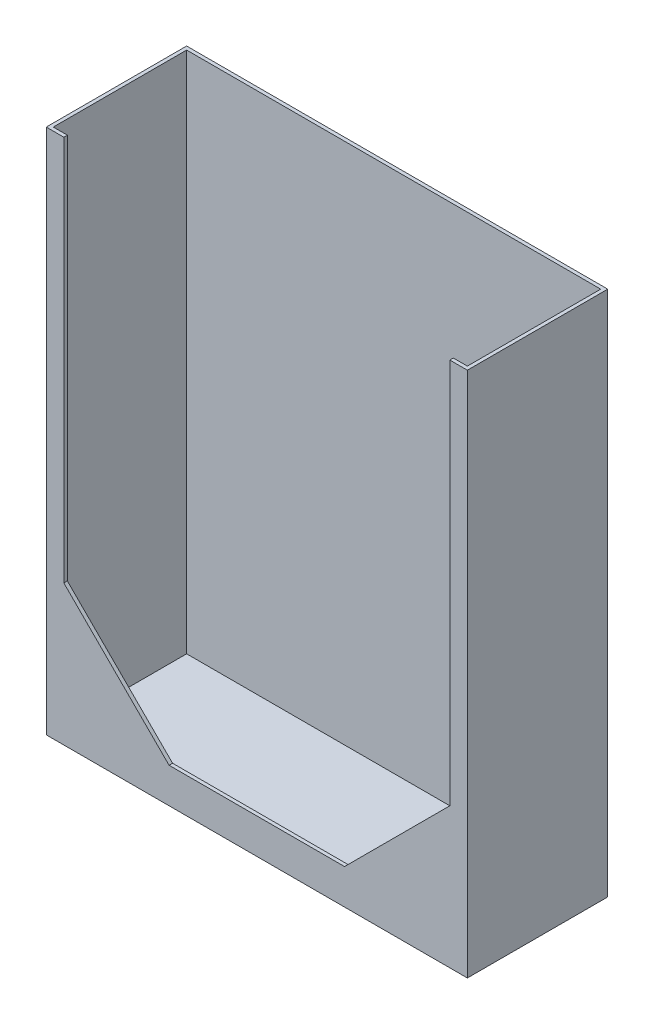
from build123d import *

# Parameters (mm, degrees)
SKETCH1_W           = 304.8
SKETCH1_H           = 101.6
BOSS_EXTRUDE1_DEPTH = 190.5
SHELL1_T            = -2.54
CUT_EXTRUDE1_REACH  = 266.27


with BuildPart() as part:
    # Sketch1 → Boss-Extrude1 (new, symmetric)
    with BuildSketch(Plane(origin=(0, 0, 0), x_dir=(1, 0, 0), z_dir=(0, 1, 0))):
        Rectangle(SKETCH1_W, SKETCH1_H)
    extrude(amount=BOSS_EXTRUDE1_DEPTH, both=True)

    # Shell1
    shell1_openings = [part.faces().sort_by_distance(p)[0] for p in [
        (0, 190.5, 0),
    ]]
    offset(amount=SHELL1_T, openings=shell1_openings, kind=Kind.INTERSECTION)

    # Sketch2 → Cut-Extrude1 (cut, up to next)
    with BuildSketch(Plane.XY.offset(50.8), mode=Mode.PRIVATE) as cut_extrude1_sk1:
        Polygon((-139.7, 190.5), (139.7, 190.5), (139.7, -88.9), (63.5, -165.1), (-63.5, -165.1), (-139.7, -88.9), align=None)
    cut_extrude1_tool1 = extrude(cut_extrude1_sk1.sketch, amount=-CUT_EXTRUDE1_REACH, mode=Mode.PRIVATE) & part.part
    add(cut_extrude1_tool1.solids().sort_by_distance((0, 22.15931, 50.8))[0], mode=Mode.SUBTRACT)


solid = part.part
